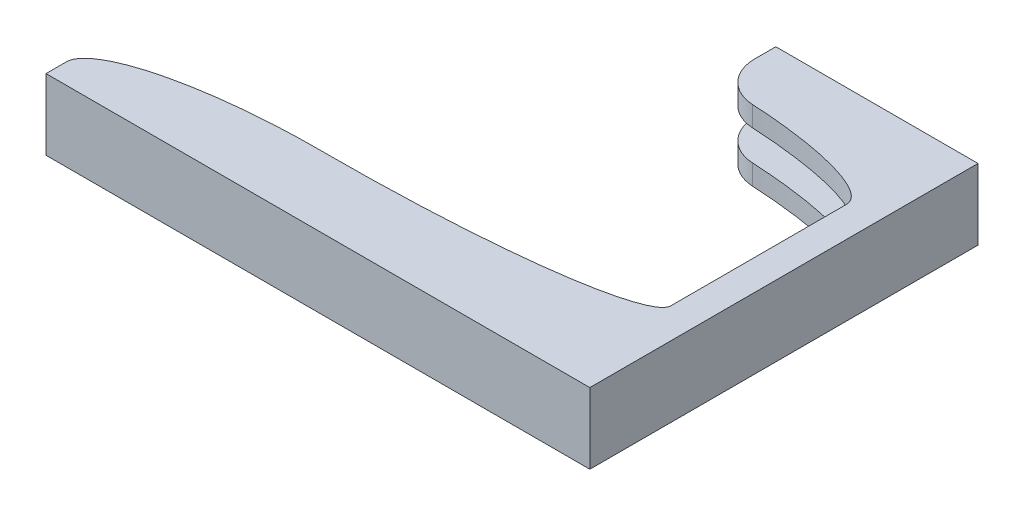
from build123d import *

# Parameters (mm, degrees)
SKETCH1_W           = 26.9
SKETCH1_H           = 19.2
BOSS_EXTRUDE1_DEPTH = 3.5
CUT_EXTRUDE3_DEPTH  = 3.5
SKETCH4_W           = 17.2
SKETCH4_H           = 1.5
CUT_EXTRUDE4_DEPTH  = 25.9
FILLET1_DEPTH       = 1
FILLET2_START       = 2.5
FILLET2_DEPTH       = 1
FILLET3_SIZE        = 8.5
FILLET3_SIZE_2      = 2
FILLET4_START       = 2.5
FILLET4_DEPTH       = 1
FILLET6_SIZE        = 10
FILLET6_SIZE_2      = 2.5
FILLET7_SIZE        = 2.5
FILLET7_SIZE_2      = 10
FILLET8_R           = 2
FILLET9_R           = 2


with BuildPart() as part:
    # Sketch1 → Boss-Extrude1 (new body)
    with BuildSketch(Plane(origin=(0, 0, 0), x_dir=(1, 0, 0), z_dir=(0, 1, 0))):
        with Locations((-44.670982611, -27.213166741)):
            Rectangle(SKETCH1_W, SKETCH1_H)
    extrude(amount=BOSS_EXTRUDE1_DEPTH)

    # Sketch2 → Cut-Extrude3 (cut)
    with BuildSketch(Plane(origin=(0, 3.5, 0), x_dir=(1, 0, 0), z_dir=(0, 1, 0))):
        Polygon((-58.120982611, -33.313166741), (-32.720982611, -33.313166741), (-32.720982611, -20.613166741), (-41.220982611, -20.613166741), (-41.220982611, -17.613166741), (-58.120982611, -17.613166741), align=None)
    extrude(amount=-CUT_EXTRUDE3_DEPTH, mode=Mode.SUBTRACT)

    # Sketch4 → Cut-Extrude4 (cut)
    with BuildSketch(Plane.ZY.offset(58.120982611)):
        with Locations((27.213166741, 1.75)):
            Rectangle(SKETCH4_W, SKETCH4_H)
    extrude(amount=-CUT_EXTRUDE4_DEPTH, mode=Mode.SUBTRACT)

    # Fillet1: read off the stored shape, not the designer's step
    # Fillet1 outline → Fillet1 (add)
    with BuildSketch(Plane(origin=(0, 0, 0), x_dir=(1, 0, 0), z_dir=(0, 1, 0))):
        with BuildLine():
            add(Edge.make_bspline(
                [(-47.720982611, -33.313166741), (-32.720982611, -33.313166741), (-32.720982611, -31.313166741)],
                knots=[0, 0, 0, 1, 1, 1], degree=2, weights=[1, 0.707106781, 1]))
            Line((-47.720982611, -33.313166741), (-32.720982611, -33.313166741))
            Line((-32.720982611, -33.313166741), (-32.720982611, -31.313166741))
        make_face()
    extrude(amount=FILLET1_DEPTH)

    # Fillet2: read off the stored shape, not the designer's step
    # Fillet2 outline → Fillet2 (add)
    with BuildSketch(Plane(origin=(0, 0, 0), x_dir=(1, 0, 0), z_dir=(0, 1, 0)).offset(FILLET2_START)):
        with BuildLine():
            add(Edge.make_bspline(
                [(-47.720982611, -33.313166741), (-32.720982611, -33.313166741), (-32.720982611, -31.313166741)],
                knots=[0, 0, 0, 1, 1, 1], degree=2, weights=[1, 0.707106781, 1]))
            Line((-47.720982611, -33.313166741), (-32.720982611, -33.313166741))
            Line((-32.720982611, -33.313166741), (-32.720982611, -31.313166741))
        make_face()
    extrude(amount=FILLET2_DEPTH)

    # Fillet3
    # a fillet whose section is not a circle: 8.5, 2 mm, written as the material it adds along each edge
    with BuildSketch(Plane(origin=(-32.720982611, 1, 20.613166741), x_dir=(-1, 0, 0), z_dir=(0, -1, 0))) as fillet3_piece_1:
        with BuildLine():
            Bezier((FILLET3_SIZE, 0), (0, 0), (0, -FILLET3_SIZE_2), weights=[1, 0.707106781, 1])
            Line((0, -FILLET3_SIZE_2), (0, 0))
            Line((0, 0), (FILLET3_SIZE, 0))
        make_face()
    extrude(amount=1)

    # Fillet4: read off the stored shape, not the designer's step
    # Fillet4 outline → Fillet4 (add)
    with BuildSketch(Plane(origin=(0, 0, 0), x_dir=(1, 0, 0), z_dir=(0, 1, 0)).offset(FILLET4_START)):
        with BuildLine():
            Line((-32.720982611, -20.613166741), (-41.220982611, -20.613166741))
            add(Edge.make_bspline(
                [(-41.220982611, -20.613166741), (-32.720982611, -20.613166741), (-32.720982611, -22.613166741)],
                knots=[0, 0, 0, 1, 1, 1], degree=2, weights=[1, 0.707106781, 1]))
            Line((-32.720982611, -22.613166741), (-32.720982611, -20.613166741))
        make_face()
    extrude(amount=FILLET4_DEPTH)

    # Fillet6
    # a fillet whose section is not a circle: 10, 2.5 mm, written as the material it takes off along each edge
    with BuildSketch(Plane(origin=(-58.120982611, 26, 33.313166741), x_dir=(1, 0, 0), z_dir=(0, -1, 0))) as fillet6_piece_1_section:
        with BuildLine():
            Bezier((FILLET6_SIZE, 0), (0, 0), (0, FILLET6_SIZE_2), weights=[1, 0.707106781, 1])
            Line((0, FILLET6_SIZE_2), (0, 0))
            Line((0, 0), (FILLET6_SIZE, 0))
        make_face()
    fillet6_piece_1 = extrude(amount=51, mode=Mode.PRIVATE)
    fillet6_piece_1 = split(fillet6_piece_1, bisect_by=Plane(origin=(-58.120982611, 2.5, 33.313166741), z_dir=(0, -1, 0)), keep=Keep.TOP, mode=Mode.PRIVATE)
    add(fillet6_piece_1, mode=Mode.SUBTRACT)

    # Fillet7
    # a fillet whose section is not a circle: 10, 2.5 mm, written as the material it takes off along each edge
    with BuildSketch(Plane(origin=(-58.120982611, 28.5, 33.313166741), x_dir=(0, 0, 1), z_dir=(0, -1, 0))) as fillet7_piece_1:
        with BuildLine():
            Bezier((FILLET7_SIZE, 0), (0, 0), (0, -FILLET7_SIZE_2), weights=[1, 0.707106781, 1])
            Line((0, -FILLET7_SIZE_2), (0, 0))
            Line((0, 0), (FILLET7_SIZE, 0))
        make_face()
    extrude(amount=51, mode=Mode.SUBTRACT)

    # Fillet8
    fillet8_edges = [part.edges().sort_by_distance(p)[0] for p in [
        (-41.220982611, 0.5, 20.613166741),
    ]]
    fillet(fillet8_edges, radius=FILLET8_R)

    # Fillet9
    fillet9_edges = [part.edges().sort_by_distance(p)[0] for p in [
        (-41.220982611, 3, 20.613166741),
    ]]
    fillet(fillet9_edges, radius=FILLET9_R)


solid = part.part
